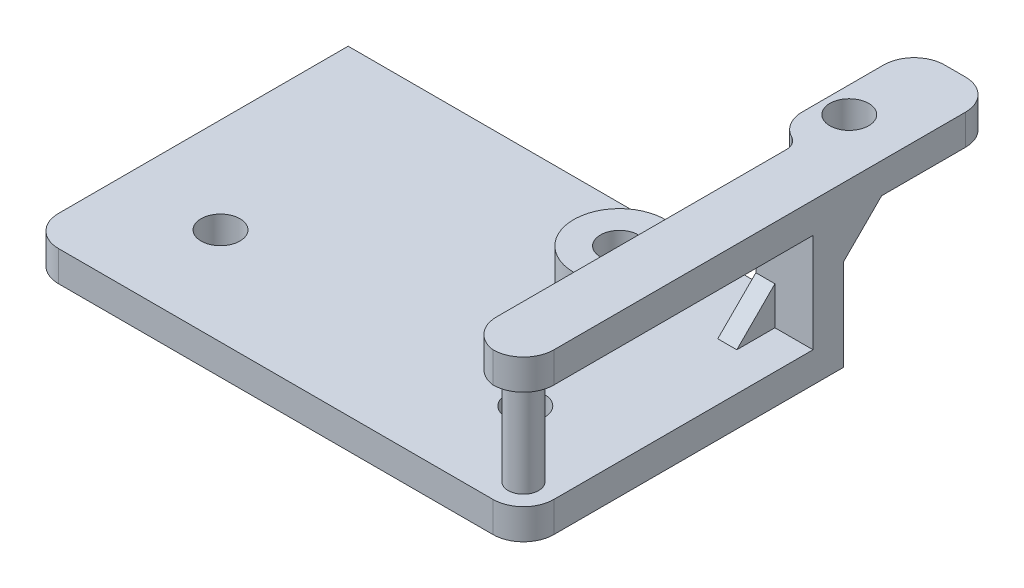
from build123d import *

# Parameters (mm, degrees)
SKETCH1_R                = 2.55
BOSS_EXTRUDE1_DEPTH      = 4
SKETCH2_R                = 2
SKETCH2_W                = 65
SKETCH2_H                = 4
BOSS_EXTRUDE2_DEPTH      = 13
BOSS_EXTRUDE3_DEPTH      = 4
SKETCH4_W                = 65
SKETCH4_H                = 4
BOSS_EXTRUDE4_DEPTH      = 20
FILLET1_R                = 4
SKETCH6_R                = 2.55
CUT_EXTRUDE1_DEPTH       = 20
SKETCH7_W                = 46
SKETCH7_H                = 4
CUT_EXTRUDE2_DEPTH       = 80
BOSS_EXTRUDE6_DEPTH      = 2.5
BOSS_EXTRUDE6_DEPTH_BACK = 2.5
CUT_EXTRUDE3_REACH       = 94.25
FILLET2_R                = 4
SKETCH8_R                = 6
SKETCH8_R_2              = 2.5
BOSS_EXTRUDE5_DEPTH      = 5
FILLET3_R                = 4
BOSS_EXTRUDE7_START      = 4
BOSS_EXTRUDE7_DEPTH      = 3.5
SKETCH13_R               = 4.5
CUT_EXTRUDE4_DEPTH       = 6
SKETCH14_W               = 13.282344927
SKETCH14_H               = 18
CUT_EXTRUDE5_DEPTH       = 6
FILLET5_R                = 4


with BuildPart() as part:
    # Sketch1 → Boss-Extrude1 (new body)
    with BuildSketch(Plane(origin=(0, 0, 0), x_dir=(1, 0, 0), z_dir=(0, 1, 0))):
        with BuildLine():
            Line((4, 0), (61, 0))
            ThreePointArc((61, 0), (63.828427125, 1.171572875), (65, 4))
            Line((65, 4), (65, 42))
            Line((65, 42), (0, 42))
            Line((0, 42), (0, 4))
            ThreePointArc((0, 4), (1.171572875, 1.171572875), (4, 0))
        make_face()
        with Locations(Location((12.5, 12.75, 0), (0, 0, 270))):
            Circle(SKETCH1_R, mode=Mode.SUBTRACT)
        with Locations(Location((52.5, 12.75, 0), (0, 0, 270))):
            Circle(SKETCH1_R, mode=Mode.SUBTRACT)
    extrude(amount=BOSS_EXTRUDE1_DEPTH)

    # Sketch2 → Boss-Extrude2 (add)
    with BuildSketch(Plane(origin=(0, 4, 0), x_dir=(1, 0, 0), z_dir=(0, 1, 0))):
        with Locations(Location((61, 4, 0), (0, 0, 90))):
            Circle(SKETCH2_R)
        with Locations(Location((4, 4, 0), (0, 0, 90))):
            Circle(SKETCH2_R)
        with Locations((32.5, 40)):
            Rectangle(SKETCH2_W, SKETCH2_H)
    extrude(amount=BOSS_EXTRUDE2_DEPTH)

    # Sketch3 → Boss-Extrude3 (add)
    with BuildSketch(Plane(origin=(0, 17, 0), x_dir=(1, 0, 0), z_dir=(0, 1, 0))):
        with BuildLine():
            Line((0, 42), (65, 42))
            Line((65, 42), (65, 4))
            ThreePointArc((65, 4), (63.828427125, 1.171572875), (61, 0))
            Line((61, 0), (4, 0))
            ThreePointArc((4, 0), (1.171572875, 1.171572875), (0, 4))
            Line((0, 4), (0, 42))
        make_face()
    extrude(amount=BOSS_EXTRUDE3_DEPTH)

    # Sketch4 → Boss-Extrude4 (add)
    with BuildSketch(Plane(origin=(0, 0, -42), x_dir=(-1, 0, 0), z_dir=(0, 0, -1))):
        with Locations((-32.5, 19)):
            Rectangle(SKETCH4_W, SKETCH4_H)
    extrude(amount=BOSS_EXTRUDE4_DEPTH)

    # Fillet1
    fillet1_edges = [part.edges().sort_by_distance(p)[0] for p in [
        (65, 19, -62),
        (0, 19, -62),
    ]]
    fillet(fillet1_edges, radius=FILLET1_R)

    # Sketch6 → Cut-Extrude1 (cut)
    with BuildSketch(Plane(origin=(0, 21, 0), x_dir=(1, 0, 0), z_dir=(0, 1, 0))):
        with Locations(Location((57.65, 50.10433299, 0), (0, 0, 270))):
            Circle(SKETCH6_R)
        with Locations(Location((45.5, 32.10433299, 0), (0, 0, 270))):
            Circle(SKETCH6_R)
    extrude(amount=-CUT_EXTRUDE1_DEPTH, mode=Mode.SUBTRACT)

    # Sketch7 → Cut-Extrude2 (cut)
    with BuildSketch(Plane.XY):
        Polygon((4, 17), (4, 21), (0, 21), (0, 4), (50, 4), (50, 17), align=None)
        with Locations((27, 19)):
            Rectangle(SKETCH7_W, SKETCH7_H)
    extrude(amount=-CUT_EXTRUDE2_DEPTH, mode=Mode.SUBTRACT)

    # Sketch10 → Boss-Extrude6 (add, two sides: drawn at the far end of the back side and taken through both)
    with BuildSketch(Plane(origin=(57.5, 0, 0), x_dir=(0, 0, -1), z_dir=(1, 0, 0)).offset(-BOSS_EXTRUDE6_DEPTH_BACK)):
        Polygon((33, 4), (38, 9), (38, 4), align=None)
    extrude(amount=BOSS_EXTRUDE6_DEPTH + BOSS_EXTRUDE6_DEPTH_BACK)

    # Cut-Extrude3: up to this face of the body (flat: up to its plane)
    cut_extrude3_end = Plane(part.part.faces().sort_by_distance((31.428078694, 4, -20.594205602))[0])
    # Sketch11 → Cut-Extrude3 (cut, up to the picked face)
    with BuildSketch(Plane(origin=(0, 21, 0), x_dir=(1, 0, 0), z_dir=(0, 1, 0)), mode=Mode.PRIVATE) as cut_extrude3_sk1:
        with BuildLine():
            Line((57.5, 0), (57.5, 42))
            ThreePointArc((57.5, 42), (56.914213562, 43.414213562), (55.5, 44))
            Line((55.5, 44), (50, 44))
            Line((50, 44), (50, 0))
            Line((50, 0), (57.5, 0))
        make_face()
    cut_extrude3_tool1 = split(extrude(cut_extrude3_sk1.sketch, amount=-CUT_EXTRUDE3_REACH, mode=Mode.PRIVATE), bisect_by=cut_extrude3_end, keep=Keep.BOTH, mode=Mode.PRIVATE)
    add(cut_extrude3_tool1.solids().sort_by(Axis((53.741385, 21, -21.943789), (0, -1, 0)))[0], mode=Mode.SUBTRACT)

    # Fillet2
    # the kernel refuses this fillet: 4 mm, written as the material it takes off along each edge
    with BuildSketch(Plane(origin=(57.5, 30.921567416, 0), x_dir=(1, 0, 0), z_dir=(0, -1, 0))) as fillet2_piece_1:
        with BuildLine():
            CenterArc((4, -3.968626967), FILLET2_R, 97.180755781, 82.819244219)
            Line((0, -3.968626967), (-0.08, -3.968626967))
            Line((-0.08, -3.968626967), (-0.08, 0))
            Line((-0.08, 0), (0, 0.08))
            ThreePointArc((0, 0.08), (1.75, 0.08), (3.49, 0.079372539))
            Line((3.49, 0.079372539), (3.5, 0))
        make_face()
    extrude(amount=23.843134833, mode=Mode.SUBTRACT)

    # Sketch8 → Boss-Extrude5 (add)
    with BuildSketch(Plane(origin=(0, 4, 0), x_dir=(1, 0, 0), z_dir=(0, 1, 0))):
        with Locations(Location((45.5, 32.10433299, 0), (0, 0, 270))):
            Circle(SKETCH8_R)
        with Locations(Location((45.5, 32.10433299, 0), (0, 0, 270))):
            Circle(SKETCH8_R_2, mode=Mode.SUBTRACT)
    extrude(amount=BOSS_EXTRUDE5_DEPTH)

    # Fillet3
    fillet3_edges = [part.edges().sort_by_distance(p)[0] for p in [
        (50, 19, -62),
    ]]
    fillet(fillet3_edges, radius=FILLET3_R)

    # Sketch12 → Boss-Extrude7 (add)
    with BuildSketch(Plane(origin=(57.5, 0, 0), x_dir=(0, 0, -1), z_dir=(1, 0, 0)).offset(BOSS_EXTRUDE7_START)):
        Polygon((42, 12), (47, 17), (42, 17), align=None)
    extrude(amount=BOSS_EXTRUDE7_DEPTH)

    # Sketch13 → Cut-Extrude4 (cut)
    with BuildSketch(Plane.XZ):
        with Locations(Location((45.5, -32.10433299, 0), (0, 0, 270))):
            Circle(SKETCH13_R)
    extrude(amount=-CUT_EXTRUDE4_DEPTH, mode=Mode.SUBTRACT)

    # Sketch14 → Cut-Extrude5 (cut)
    with BuildSketch(Plane(origin=(0, 21, 0), x_dir=(1, 0, 0), z_dir=(0, 1, 0))):
        with Locations((47.623272126, 53)):
            Rectangle(SKETCH14_W, SKETCH14_H)
    extrude(amount=-CUT_EXTRUDE5_DEPTH, mode=Mode.SUBTRACT)

    # Fillet5
    fillet5_edges = [part.edges().sort_by_distance(p)[0] for p in [
        (54.264444589, 19, -62),
        (54.264444589, 19, -44),
    ]]
    fillet(fillet5_edges, radius=FILLET5_R)


solid = part.part
